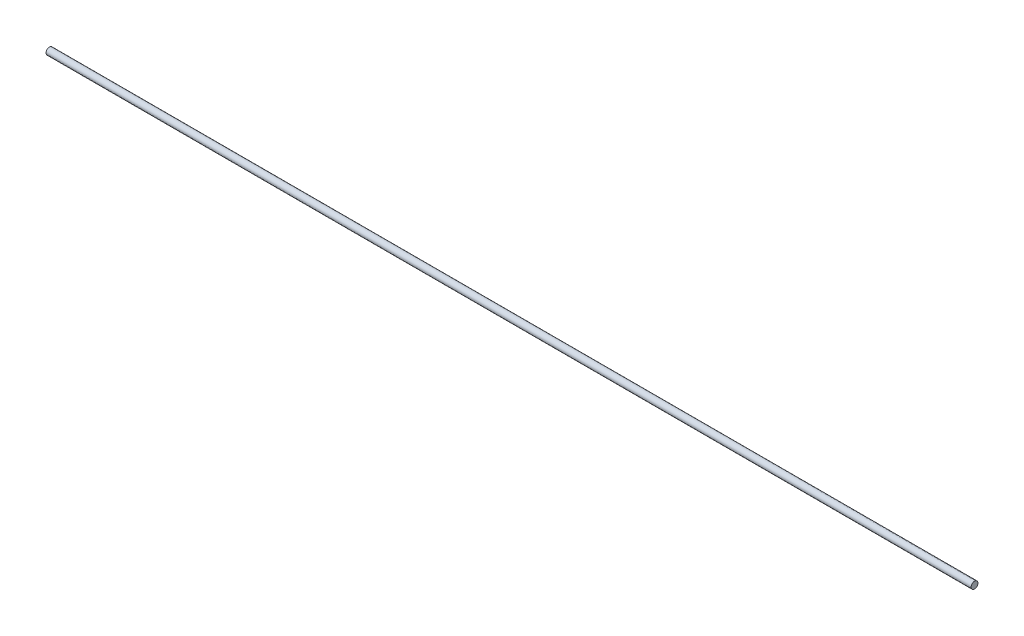
from build123d import *

# Parameters (mm, degrees)
SKETCH1_R           = 3
BOSS_EXTRUDE1_DEPTH = 812.8


with BuildPart() as part:
    # Sketch1 → Boss-Extrude1 (new body)
    with BuildSketch(Plane(origin=(0, 0, 0), x_dir=(0, 0, -1), z_dir=(1, 0, 0))):
        with Locations((4.795611117, 16.226241471)):
            Circle(SKETCH1_R)
    extrude(amount=BOSS_EXTRUDE1_DEPTH)


solid = part.part
